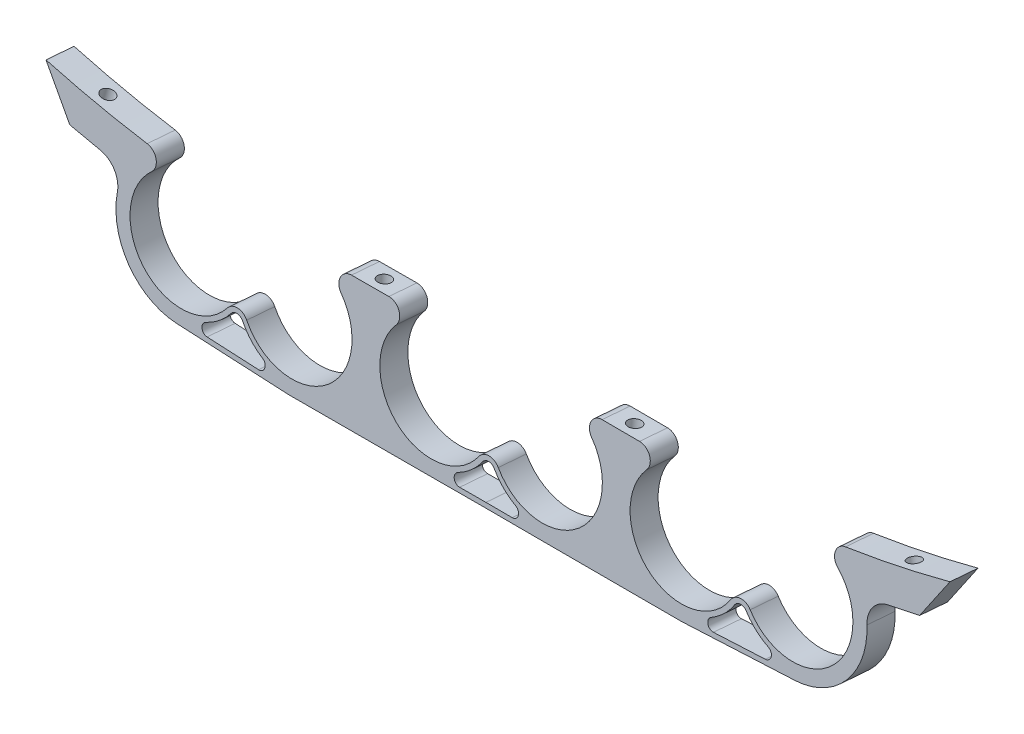
from build123d import *

# Parameters (mm, degrees)
BOSS_EXTRUDE3_START = -3.81
BOSS_EXTRUDE3_DEPTH = 7.62
SKETCH5_R           = 2.921
CUT_EXTRUDE2_DEPTH  = 3.556
SKETCH6_R           = 1.778
CUT_EXTRUDE3_DEPTH  = 304.601904377
SKETCH9_R           = 2.921
CUT_EXTRUDE4_DEPTH  = 3.556
SKETCH10_R          = 1.778
CUT_EXTRUDE5_DEPTH  = 6.35
CUT_EXTRUDE1_DEPTH  = 131.217316215


# Read off the part's stored shape, not the designer's step: Boss-Extrude3
with BuildPart() as part:
    # Boss-Extrude3 outline → Boss-Extrude3 (new body)
    with BuildSketch(Plane(origin=(-1.37e-07, -21.320637117, -267.267787728), x_dir=(-1.0, 4.0603937450412534e-11, 5.089962591579001e-10), z_dir=(-5.106132309030127e-10, -0.07951994776673735, -0.9968332748795936)).offset(BOSS_EXTRUDE3_START)):
        with BuildLine():
            Line((112.106295927, 7.231939959), (120.618075674, 8.920791964))
            Line((120.618075674, 8.920791964), (127.952899508, 20.086799916))
            add(Edge.make_bspline(
                [(127.952899508, 20.086799916), (127.733453866, 20.031869987), (124.790640232, 19.298882144), (115.665772436, 17.176795884), (106.567009529, 15.505553999), (100.196966873, 14.574359348), (100.096829018, 14.559779491)],
                knots=[0.190166923, 0.190166923, 0.190166923, 0.190166923, 0.194630472, 0.250006631, 0.374995485, 0.376991536, 0.376991536, 0.376991536, 0.376991536], degree=3))
            ThreePointArc((100.096829018, 14.559779491), (97.516956059, 12.342728002), (98.423479164, 9.064118899))
            ThreePointArc((98.423479164, 9.064118899), (98.477096611, -13.201016224), (76.306343705, -11.152399019))
            ThreePointArc((76.306343705, -11.152399019), (73.622973418, -9.892155725), (71.068729377, -11.396990147))
            ThreePointArc((71.068729377, -11.396990147), (49.348239318, -15.626865255), (46.891898762, 6.36490418))
            ThreePointArc((46.891898762, 6.36490418), (47.386404311, 9.755192952), (44.512726357, 11.620821187))
            add(Edge.make_bspline(
                [(44.512726357, 11.620821187), (44.178560875, 11.622797852), (40.800632484, 11.642687098), (37.42267555, 11.658993975), (34.378885047, 11.661151613)],
                knots=[0.743385966, 0.743385966, 0.743385966, 0.743385966, 0.749978398, 0.810025859, 0.810025859, 0.810025859, 0.810025859], degree=3))
            ThreePointArc((34.378885047, 11.661151613), (31.492596885, 9.813914668), (31.965930783, 6.419964358))
            ThreePointArc((31.965930783, 6.419964358), (29.693608595, -15.318815094), (8.111559748, -11.861482634))
            ThreePointArc((8.111559748, -11.861482634), (6.972140925, -10.844475255), (5.489695638, -10.477139937))
            Line((5.489695638, -10.477139937), (5.489695638, -22.273944445))
            Line((5.489695638, -22.273944445), (20.51889166, -22.314566997))
            Line((20.51889166, -22.314566997), (58.195903663, -22.358288583))
            ThreePointArc((58.195903663, -22.358288583), (58.66769947, -22.353952101), (59.139239163, -22.337814984))
            Line((59.139239163, -22.337814984), (89.204531551, -20.931744632))
            ThreePointArc((89.204531551, -20.931744632), (102.7423557, -14.249191476), (107.040205336, 0.223461628))
            ThreePointArc((107.040205336, 0.223461628), (108.195855348, 4.723353339), (112.106295927, 7.231939959))
        make_face()
    boss_extrude3 = extrude(amount=BOSS_EXTRUDE3_DEPTH)

    # Sketch5 → Cut-Extrude2 (cut)
    with BuildSketch(Plane(origin=(0.025866858, -22.220137612, 1.772557384), x_dir=(0.9999993267002099, 0.0011567558136527983, -9.22773789738946e-05), z_dir=(0.0011604305783155834, -0.9968326037120059, 0.07951989422538247))):
        with Locations(Location((-39.383291171, -268.116840031, 0), (0, 0, 270))):
            Circle(SKETCH5_R)
    cut_extrude2 = extrude(amount=-CUT_EXTRUDE2_DEPTH, mode=Mode.SUBTRACT)

    # Sketch6 → Cut-Extrude3 (cut, through all)
    with BuildSketch(Plane(origin=(0.021740367, -18.675400874, 1.48978464), x_dir=(0.9999993267002099, 0.0011567558136527992, -9.227737897389464e-05), z_dir=(0.0011604305783155843, -0.996832603712006, 0.07951989422538246))):
        with Locations(Location((-39.383291171, -268.116840031, 0), (0, 0, 270))):
            Circle(SKETCH6_R)
    cut_extrude3 = extrude(amount=-CUT_EXTRUDE3_DEPTH, mode=Mode.SUBTRACT)

    # Sketch9 → Cut-Extrude4 (cut)
    with BuildSketch(Plane(origin=(-2.865661678, -14.397139935, 1.148496791), x_dir=(0.9808787965129323, -0.19400328770884323, 0.015476140006521559), z_dir=(-0.1946195944691635, -0.9777726229800385, 0.07799943076326918))):
        with Locations(Location((-115.872057448, -268.116839998, 0), (0, 0, 359.110537043))):
            Circle(SKETCH9_R)
    cut_extrude4 = extrude(amount=-CUT_EXTRUDE4_DEPTH, mode=Mode.SUBTRACT)

    # Sketch10 → Cut-Extrude5 (cut)
    with BuildSketch(Plane(origin=(-2.1735944, -10.920180488, 0.871130815), x_dir=(0.9808787965129323, -0.1940032877088668, 0.015476140006226465), z_dir=(-0.19461959446916352, -0.9777726229800384, 0.07799943076326925))):
        with Locations(Location((-115.872057447, -268.116839998, 0), (0, 0, 359.110537043))):
            Circle(SKETCH10_R)
    cut_extrude5 = extrude(amount=-CUT_EXTRUDE5_DEPTH, mode=Mode.SUBTRACT)

    # Mirror1: Boss-Extrude3, Cut-Extrude2, Cut-Extrude3, Cut-Extrude4, Cut-Extrude5 across plane
    add(boss_extrude3.mirror(Plane(origin=(-5.489695773, -21.017666116, -263.469852948), x_dir=(5.089962591579002e-10, 0, 1.0), z_dir=(1.0, -4.060393745041131e-11, -5.089962591579002e-10))))
    add(cut_extrude2.mirror(Plane(origin=(-5.489695773, -21.017666116, -263.469852948), x_dir=(5.089962591579002e-10, 0, 1.0), z_dir=(1.0, -4.060393745041131e-11, -5.089962591579002e-10))), mode=Mode.SUBTRACT)
    add(cut_extrude3.mirror(Plane(origin=(-5.489695773, -21.017666116, -263.469852948), x_dir=(5.089962591579002e-10, 0, 1.0), z_dir=(1.0, -4.060393745041131e-11, -5.089962591579002e-10))), mode=Mode.SUBTRACT)
    add(cut_extrude4.mirror(Plane(origin=(-5.489695773, -21.017666116, -263.469852948), x_dir=(5.089962591579002e-10, 0, 1.0), z_dir=(1.0, -4.060393745041131e-11, -5.089962591579002e-10))), mode=Mode.SUBTRACT)
    add(cut_extrude5.mirror(Plane(origin=(-5.489695773, -21.017666116, -263.469852948), x_dir=(5.089962591579002e-10, 0, 1.0), z_dir=(1.0, -4.060393745041131e-11, -5.089962591579002e-10))), mode=Mode.SUBTRACT)

    # Sketch3 → Cut-Extrude1 (cut, through all)
    with BuildSketch(Plane(origin=(-1.39e-07, -21.623608118, -271.065722506), x_dir=(-1.0, 4.060393976479613e-11, 5.089962881701749e-10), z_dir=(-5.106132600074531e-10, -0.07951994776673733, -0.9968332748795936))):
        with BuildLine():
            Line((-70.137381903, -20.038598566), (-56.128628862, -20.693749099))
            ThreePointArc((-56.128628862, -20.693749099), (-54.528546891, -19.545845584), (-55.276507323, -17.724170534))
            ThreePointArc((-55.276507323, -17.724170534), (-58.583492798, -15.268733388), (-61.170372338, -12.0635222))
            ThreePointArc((-61.170372356, -12.063522211), (-62.702914232, -11.160769029), (-64.312847426, -11.916919159))
            ThreePointArc((-64.312847426, -11.916919159), (-67.187321276, -14.866479835), (-70.708687783, -17.002477499))
            ThreePointArc((-70.708687783, -17.002477499), (-71.62334002, -18.746399054), (-70.137381903, -20.038598566))
        make_face()
        with BuildLine():
            Line((-1.638788789, -21.023207452), (5.489695638, -21.003939806))
            Line((5.489695638, -21.003939806), (12.618178526, -21.023207448))
            ThreePointArc((12.618178526, -21.023207448), (14.168049432, -19.798125894), (13.324308064, -18.011781823))
            ThreePointArc((13.324308064, -18.011781823), (9.842731649, -15.699015019), (7.062814103, -12.577745555))
            ThreePointArc((7.062814103, -12.577745555), (5.489695638, -11.747139939), (3.916577173, -12.577745556))
            ThreePointArc((3.916577173, -12.577745556), (1.136659647, -15.699015001), (-2.34491674, -18.011781799))
            ThreePointArc((-2.34491674, -18.011781799), (-3.188658338, -19.798125119), (-1.638788789, -21.023207452))
        make_face()
        with BuildLine():
            ThreePointArc((66.255898599, -17.724170534), (65.507938167, -19.545845584), (67.108020138, -20.693749099))
            Line((67.108020138, -20.693749099), (81.116773179, -20.038598566))
            ThreePointArc((81.116773179, -20.038598566), (82.602731296, -18.746399054), (81.688079059, -17.002477499))
            ThreePointArc((81.688079059, -17.002477499), (78.166712552, -14.866479835), (75.292238702, -11.916919159))
            ThreePointArc((75.292238702, -11.916919159), (73.682305508, -11.160769029), (72.149763632, -12.063522211))
            ThreePointArc((72.149763614, -12.0635222), (69.562884074, -15.268733388), (66.255898599, -17.724170534))
        make_face()
    extrude(amount=-CUT_EXTRUDE1_DEPTH, mode=Mode.SUBTRACT)


solid = part.part
